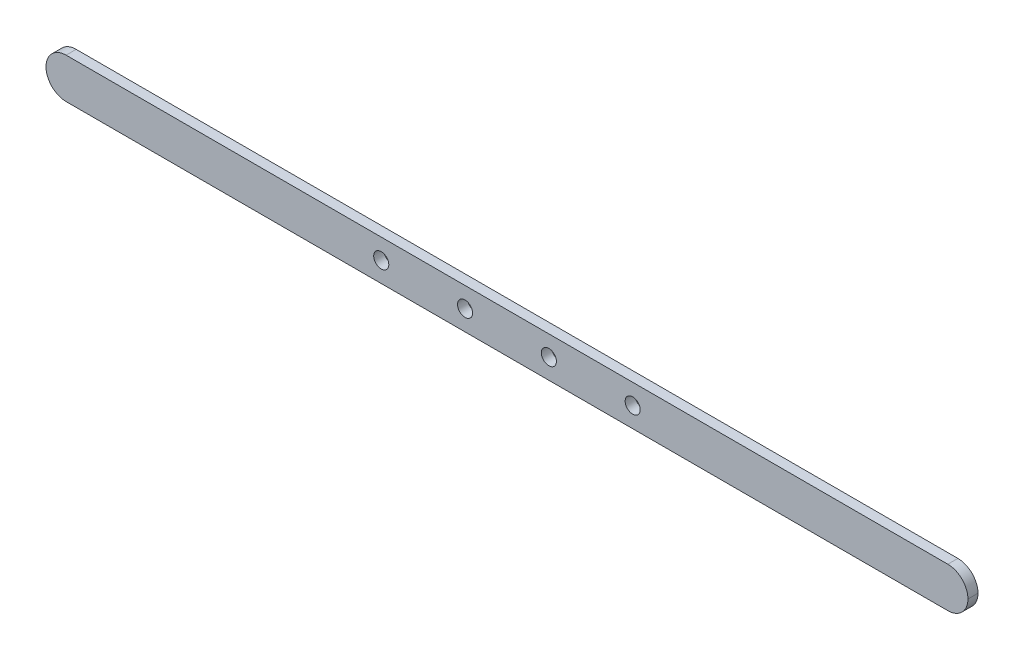
from build123d import *

# Parameters (mm, degrees)
SKETCH1_W           = 550
SKETCH1_H           = 24
SKETCH1_R           = 4.5
BOSS_EXTRUDE1_DEPTH = 6
FILLET2_R           = 12


with BuildPart() as part:
    # Sketch1 → Boss-Extrude1 (new body)
    with BuildSketch(Plane.XY):
        Rectangle(SKETCH1_W, SKETCH1_H)
        with Locations((75, 0)):
            Circle(SKETCH1_R, mode=Mode.SUBTRACT)
        with Locations((25, 0)):
            Circle(SKETCH1_R, mode=Mode.SUBTRACT)
        with Locations((-25, 0)):
            Circle(SKETCH1_R, mode=Mode.SUBTRACT)
        with Locations((-75, 0)):
            Circle(SKETCH1_R, mode=Mode.SUBTRACT)
    extrude(amount=BOSS_EXTRUDE1_DEPTH)

    # Fillet2
    fillet2_edges = [part.edges().sort_by_distance(p)[0] for p in [
        (-275, -12, 3),
        (-275, 12, 3),
        (275, 12, 3),
        (275, -12, 3),
    ]]
    fillet(fillet2_edges, radius=FILLET2_R - 0.0001)  # a hair under: the kernel refuses the full size


solid = part.part
